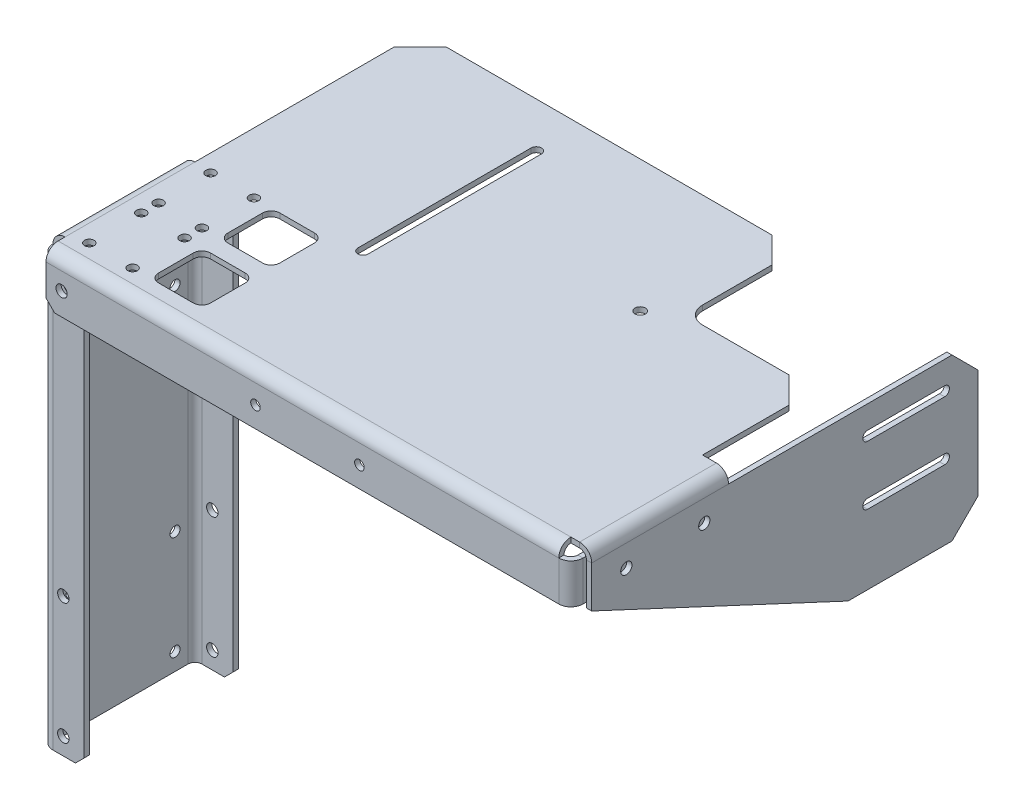
from build123d import *

# Parameters (mm, degrees)
ODGI_CIE_BAZOWE1_DEPTH                            = 37.5
ODGI_CIE_KRAW_DZI1_DEPTH                          = 296
ODGI_CIE_KRAW_DZI2_DEPTH                          = 246
ODGI_CIE_KRAW_DZI2_BEND_DEPTH                     = 246
OTW_R_POD_RUB_M51_D                               = 5.8
OTW_R_POD_RUB_M51_DEPTH                           = 10
OTW_R_POD_RUB_M51_TIP                             = 1.742495795
OTW_R_POD_RUB_M61_D                               = 6.6
ODGI_CIE_KRAW_DZI3_DEPTH                          = 79
SZKIC38_W                                         = 293
SZKIC38_H                                         = 130
WYPUST1_DEPTH                                     = 3
WYPUST2_DEPTH                                     = 3
ODGI_CIE_KRAW_DZI4_DEPTH                          = 23
SZKIC49_R                                         = 3
WYTNIJ_WYCI_GNI_CIE1_DEPTH                        = 351.991809021
SZCZELINA_START                                   = 159
SZCZELINA_POD_RUB_M53_DEPTH                       = 3
SFAZOWANIE3_SIZE                                  = 5
POG_BIENIE_WALCOWE_POD_M5_RUB_Z_BEM_S_D           = 5.5
POG_BIENIE_WALCOWE_POD_M5_RUB_Z_BEM_S_DEPTH       = 10
POG_BIENIE_WALCOWE_POD_M5_RUB_Z_BEM_S_CBORE_D     = 6.5
POG_BIENIE_WALCOWE_POD_M5_RUB_Z_BEM_S_CBORE_DEPTH = 3.7
POG_BIENIE_WALCOWE_POD_M5_RUB_Z_BEM_S_TIP         = 1.652366702
POG_BIENIE_WALCOWE_POD_M5_RUB_Z_B_2_D             = 5.5
POG_BIENIE_WALCOWE_POD_M5_RUB_Z_B_2_DEPTH         = 10
POG_BIENIE_WALCOWE_POD_M5_RUB_Z_B_2_CBORE_D       = 6.5
POG_BIENIE_WALCOWE_POD_M5_RUB_Z_B_2_CBORE_DEPTH   = 3.7
POG_BIENIE_WALCOWE_POD_M5_RUB_Z_B_2_TIP           = 1.652366702
SZKIC57_W                                         = 75
SZKIC57_H                                         = 65
WYTNIJ_WYCI_GNI_CIE2_DEPTH                        = 10
WYTNIJ_WYCI_GNI_CIE3_REACH                        = 352.992
SZKIC58_W                                         = 30
SZKIC58_H                                         = 30
SZYK_LINIOWY1_COUNT                               = 2
SZYK_LINIOWY1_PITCH                               = 40
SFAZOWANIE4_SIZE                                  = 15
ZAOKR_GLENIE1_R                                   = 10
ZAOKR_GLENIE2_R                                   = 5
OTW_R_POD_RUB_M52_D                               = 5.5
OTW_R_POD_RUB_M52_DEPTH                           = 10
OTW_R_POD_RUB_M52_TIP                             = 1.652366702
OTW_R_POD_RUB_M53_D                               = 5.5
OTW_R_POD_RUB_M53_DEPTH                           = 10
OTW_R_POD_RUB_M53_TIP                             = 1.652366702


# Read off the part's stored shape, not the designer's step: Szczelina pod śrubę M53
# Sheet-metal steps are written as plain solids
with BuildPart() as part:
    # Szkic1 → Odgięcie bazowe1 (new, symmetric)
    with BuildSketch(Plane.XY):
        with BuildLine():
            Line((-150, -250), (-150, -4))
            ThreePointArc((-150, -4), (-148.828427125, -1.171572875), (-146, 0))
            Line((-146, 0), (150, 0))
            Line((150, 0), (150, 3))
            Line((150, 3), (-146, 3))
            ThreePointArc((-146, 3), (-150.949747468, 0.949747468), (-153, -4))
            Line((-153, -4), (-153, -250))
            Line((-153, -250), (-150, -250))
        make_face()
    extrude(amount=ODGI_CIE_BAZOWE1_DEPTH, both=True)

    # Odgięcie krawędzi1 section (across the edge) → Odgięcie krawędzi1 (add)
    with BuildSketch(Plane(origin=(150, 0, 45.5), x_dir=(0, 0, -1), z_dir=(-1, 0, 0))):
        with BuildLine():
            Line((-3, 4), (-3, 27))
            Line((-3, 27), (0, 27))
            Line((0, 27), (0, 4))
            ThreePointArc((0, 4), (1.171572875, 1.171572875), (4, 0))
            Line((4, 0), (8, 0))
            Line((8, 0), (8, -3))
            Line((8, -3), (4, -3))
            ThreePointArc((4, -3), (-0.949747468, -0.949747468), (-3, 4))
        make_face()
    extrude(amount=ODGI_CIE_KRAW_DZI1_DEPTH)

    # Odgięcie krawędzi2 section (across the edge) → Odgięcie krawędzi2 (add)
    with BuildSketch(Plane(origin=(-150, -4, 41.5), x_dir=(0, 0, -1), z_dir=(0, -1, 0))):
        with BuildLine():
            Line((-3, 4), (-3, 22))
            Line((-3, 22), (0, 22))
            Line((0, 22), (0, 4))
            ThreePointArc((0, 4), (1.171572875, 1.171572875), (4, 0))
            Line((4, 0), (4, -3))
            ThreePointArc((4, -3), (-0.949747468, -0.949747468), (-3, 4))
        make_face()
    extrude(amount=ODGI_CIE_KRAW_DZI2_DEPTH)

    # Odgięcie krawędzi2 section 2 (across the edge) → Odgięcie krawędzi2 bend (add)
    with BuildSketch(Plane(origin=(-150, -250, -41.5), x_dir=(0, 0, 1), z_dir=(0, 1, 0))):
        with BuildLine():
            Line((-3, 4), (-3, 22))
            Line((-3, 22), (0, 22))
            Line((0, 22), (0, 4))
            ThreePointArc((0, 4), (1.171572875, 1.171572875), (4, 0))
            Line((4, 0), (4, -3))
            ThreePointArc((4, -3), (-0.949747468, -0.949747468), (-3, 4))
        make_face()
    extrude(amount=ODGI_CIE_KRAW_DZI2_BEND_DEPTH)

    # Otwór pod śrubę M51
    with Locations(Plane.ZY.offset(153)):
        with Locations((-30, -240), (30, -240), (-30, -180), (30, -180), (-30, -17), (-30, -57)):
            Hole(OTW_R_POD_RUB_M51_D / 2, depth=OTW_R_POD_RUB_M51_DEPTH)
            with Locations((0, 0, -(OTW_R_POD_RUB_M51_DEPTH + OTW_R_POD_RUB_M51_TIP / 2))):  # 118° drill point
                Cone(0, OTW_R_POD_RUB_M51_D / 2, OTW_R_POD_RUB_M51_TIP, mode=Mode.SUBTRACT)

    # Otwór pod śrubę M61 (through all)
    with Locations(Plane.XY.offset(44.5)):
        with Locations((-140, -240), (-140, -170)):
            Hole(OTW_R_POD_RUB_M61_D / 2)

    # Odgięcie krawędzi3 section (across the edge) → Odgięcie krawędzi3 (add)
    with BuildSketch(Plane(origin=(159, 0, -37.5), x_dir=(-1, 0, 0), z_dir=(0, 0, 1))):
        with BuildLine():
            Line((-3, 4), (-3, 28))
            Line((-3, 28), (0, 28))
            Line((0, 28), (0, 4))
            ThreePointArc((0, 4), (1.171572875, 1.171572875), (4, 0))
            Line((4, 0), (9, 0))
            Line((9, 0), (9, -3))
            Line((9, -3), (4, -3))
            ThreePointArc((4, -3), (-0.949747468, -0.949747468), (-3, 4))
        make_face()
    extrude(amount=ODGI_CIE_KRAW_DZI3_DEPTH)

    # Szkic38 → Wypust1 (add)
    with BuildSketch(Plane(origin=(0, 3, 0), x_dir=(1, 0, 0), z_dir=(0, 1, 0))):
        with Locations((0.5, 102.5)):
            Rectangle(SZKIC38_W, SZKIC38_H)
    extrude(amount=-WYPUST1_DEPTH)

    # Szkic41 → Wypust2 (add)
    with BuildSketch(Plane(origin=(162, 0, 0), x_dir=(0, 0, -1), z_dir=(1, 0, 0))):
        Polygon((37.5, -4), (181.5, -4), (181.5, -97.00689818), (106.5, -97.00689818), (-41.5, -28), (37.5, -28), align=None)
    extrude(amount=-WYPUST2_DEPTH)

    # Odgięcie krawędzi4 section (across the edge) → Odgięcie krawędzi4 (add)
    with BuildSketch(Plane(origin=(154, -4, 45.5), x_dir=(-1, 0, 0), z_dir=(0, -1, 0))):
        with BuildLine():
            Line((-3, 4), (-3, 81))
            Line((-3, 81), (0, 81))
            Line((0, 81), (0, 4))
            ThreePointArc((0, 4), (1.171572875, 1.171572875), (4, 0))
            Line((4, 0), (4, -3))
            ThreePointArc((4, -3), (-0.949747468, -0.949747468), (-3, 4))
        make_face()
    extrude(amount=ODGI_CIE_KRAW_DZI4_DEPTH)

    # Szkic49 → Wytnij-wyciągnięcie1 (cut, through all)
    with BuildSketch(Plane(origin=(0, 3, 0), x_dir=(1, 0, 0), z_dir=(0, 1, 0))):
        with Locations(Location((57, 91.5, 0), (0, 0, 270))):
            Circle(SZKIC49_R)
        with BuildLine():
            Line((-50, 141.5), (-50, 41.5))
            ThreePointArc((-50, 41.5), (-53, 38.5), (-56, 41.5))
            Line((-56, 41.5), (-56, 141.5))
            ThreePointArc((-56, 141.5), (-53, 144.5), (-50, 141.5))
        make_face()
    extrude(amount=-WYTNIJ_WYCI_GNI_CIE1_DEPTH, mode=Mode.SUBTRACT)

    # Szczelina pod śrubę M53 outline → Szczelina pod śrubę M53 (cut)
    with BuildSketch(Plane.YZ.offset(SZCZELINA_START)):
        with BuildLine():
            Line((-56.75, -117.75), (-56.75, -162.25))
            ThreePointArc((-56.75, -162.25), (-54, -165), (-51.25, -162.25))
            Line((-51.25, -162.25), (-51.25, -117.75))
            ThreePointArc((-51.25, -117.75), (-54, -115), (-56.75, -117.75))
        make_face()
        with BuildLine():
            ThreePointArc((-22.75, -162.25), (-20, -165), (-17.25, -162.25))
            Line((-17.25, -162.25), (-17.25, -117.75))
            ThreePointArc((-17.25, -117.75), (-20, -115), (-22.75, -117.75))
            Line((-22.75, -117.75), (-22.75, -162.25))
        make_face()
    extrude(amount=SZCZELINA_POD_RUB_M53_DEPTH, mode=Mode.SUBTRACT)

    # Sfazowanie3
    sfazowanie3_edges = [part.edges().sort_by_distance(p)[0] for p in [
        (155.5, -4, -35.5),
        (155.5, -27, -35.5),
        (-146, -27, 47),
        (-128, -4, 43),
        (-128, -250, 43),
        (-128, -250, -43),
        (-128, -4, -43),
    ]]
    chamfer(sfazowanie3_edges, length=SFAZOWANIE3_SIZE)

    # Pog_bienie walcowe pod M5 _rub_ z _bem s
    with Locations(Plane.XY.offset(48.5)):
        with Locations((-137, -14)):
            CounterBoreHole(POG_BIENIE_WALCOWE_POD_M5_RUB_Z_BEM_S_D / 2, POG_BIENIE_WALCOWE_POD_M5_RUB_Z_BEM_S_CBORE_D / 2, POG_BIENIE_WALCOWE_POD_M5_RUB_Z_BEM_S_CBORE_DEPTH, depth=POG_BIENIE_WALCOWE_POD_M5_RUB_Z_BEM_S_DEPTH)
            with Locations((0, 0, -(POG_BIENIE_WALCOWE_POD_M5_RUB_Z_BEM_S_DEPTH + POG_BIENIE_WALCOWE_POD_M5_RUB_Z_BEM_S_TIP / 2))):  # 118° drill point
                Cone(0, POG_BIENIE_WALCOWE_POD_M5_RUB_Z_BEM_S_D / 2, POG_BIENIE_WALCOWE_POD_M5_RUB_Z_BEM_S_TIP, mode=Mode.SUBTRACT)

    # Pog_bienie walcowe pod M5 _rub_ z _b 2
    with Locations(Plane(origin=(162, 0, 0), x_dir=(0, 0, -1), z_dir=(1, 0, 0))):
        with Locations((-21.5, -16.600519764), (23.5, -16.600519764)):
            CounterBoreHole(POG_BIENIE_WALCOWE_POD_M5_RUB_Z_B_2_D / 2, POG_BIENIE_WALCOWE_POD_M5_RUB_Z_B_2_CBORE_D / 2, POG_BIENIE_WALCOWE_POD_M5_RUB_Z_B_2_CBORE_DEPTH, depth=POG_BIENIE_WALCOWE_POD_M5_RUB_Z_B_2_DEPTH)
            with Locations((0, 0, -(POG_BIENIE_WALCOWE_POD_M5_RUB_Z_B_2_DEPTH + POG_BIENIE_WALCOWE_POD_M5_RUB_Z_B_2_TIP / 2))):  # 118° drill point
                Cone(0, POG_BIENIE_WALCOWE_POD_M5_RUB_Z_B_2_D / 2, POG_BIENIE_WALCOWE_POD_M5_RUB_Z_B_2_TIP, mode=Mode.SUBTRACT)

    # Szkic57 → Wytnij-wyciągnięcie2 (cut)
    with BuildSketch(Plane(origin=(0, 3, 0), x_dir=(1, 0, 0), z_dir=(0, 1, 0))):
        with Locations((109.5, 135)):
            Rectangle(SZKIC57_W, SZKIC57_H)
    extrude(amount=-WYTNIJ_WYCI_GNI_CIE2_DEPTH, mode=Mode.SUBTRACT)

    # Szkic58 → Wytnij-wyciągnięcie3 (cut, up to next)
    with BuildSketch(Plane(origin=(0, 3, 0), x_dir=(1, 0, 0), z_dir=(0, 1, 0)), mode=Mode.PRIVATE) as wytnij_wyci_gni_cie3_sk1:
        with Locations((-86, -18.5)):
            Rectangle(SZKIC58_W, SZKIC58_H)
    wytnij_wyci_gni_cie3_tool1 = extrude(wytnij_wyci_gni_cie3_sk1.sketch, amount=-WYTNIJ_WYCI_GNI_CIE3_REACH, mode=Mode.PRIVATE) & part.part
    wytnij_wyci_gni_cie3 = wytnij_wyci_gni_cie3_tool1.solids().sort_by_distance((-86, 3, 18.5))[0]
    add(wytnij_wyci_gni_cie3, mode=Mode.SUBTRACT)

    # Szyk liniowy1: Wytnij-wyciągnięcie3 ×2
    with Locations(*[(0, 0, -i * SZYK_LINIOWY1_PITCH) for i in range(1, SZYK_LINIOWY1_COUNT)]):
        add(wytnij_wyci_gni_cie3, mode=Mode.SUBTRACT)

    # Sfazowanie4
    sfazowanie4_edges = [part.edges().sort_by_distance(p)[0] for p in [
        (-146, 1.5, -167.5),
        (160.5, -4, -181.5),
        (160.5, -97.00689818, -181.5),
        (147, 1.5, -102.5),
        (72, 1.5, -167.5),
    ]]
    chamfer(sfazowanie4_edges, length=SFAZOWANIE4_SIZE)

    # Zaokrąglenie1
    zaokr_glenie1_edges = [part.edges().sort_by_distance(p)[0] for p in [
        (72, 1.5, -102.5),
    ]]
    fillet(zaokr_glenie1_edges, radius=ZAOKR_GLENIE1_R)

    # Zaokrąglenie2
    zaokr_glenie2_edges = [part.edges().sort_by_distance(p)[0] for p in [
        (-101, 1.5, 33.5),
        (-101, 1.5, 3.5),
        (-71, 1.5, 3.5),
        (-71, 1.5, 33.5),
        (-101, 1.5, -6.5),
        (-101, 1.5, -36.5),
        (-71, 1.5, -36.5),
        (-71, 1.5, -6.5),
    ]]
    fillet(zaokr_glenie2_edges, radius=ZAOKR_GLENIE2_R)

    # Otwór pod śrubę M52
    with Locations(Plane(origin=(0, 3, 0), x_dir=(1, 0, 0), z_dir=(0, 1, 0))):
        with Locations((-111, 36.5), (-111, -3.5), (-111, 6.5), (-111, -33.5), (-136, 36.5), (-136, -3.5), (-136, 6.5), (-136, -33.5)):
            Hole(OTW_R_POD_RUB_M52_D / 2, depth=OTW_R_POD_RUB_M52_DEPTH)
            with Locations((0, 0, -(OTW_R_POD_RUB_M52_DEPTH + OTW_R_POD_RUB_M52_TIP / 2))):  # 118° drill point
                Cone(0, OTW_R_POD_RUB_M52_D / 2, OTW_R_POD_RUB_M52_TIP, mode=Mode.SUBTRACT)

    # Otwór pod śrubę M53
    with Locations(Plane.XY.offset(48.5)):
        with Locations((-25.078617212, -15), (34.921382788, -15)):
            Hole(OTW_R_POD_RUB_M53_D / 2, depth=OTW_R_POD_RUB_M53_DEPTH)
            with Locations((0, 0, -(OTW_R_POD_RUB_M53_DEPTH + OTW_R_POD_RUB_M53_TIP / 2))):  # 118° drill point
                Cone(0, OTW_R_POD_RUB_M53_D / 2, OTW_R_POD_RUB_M53_TIP, mode=Mode.SUBTRACT)


solid = part.part
